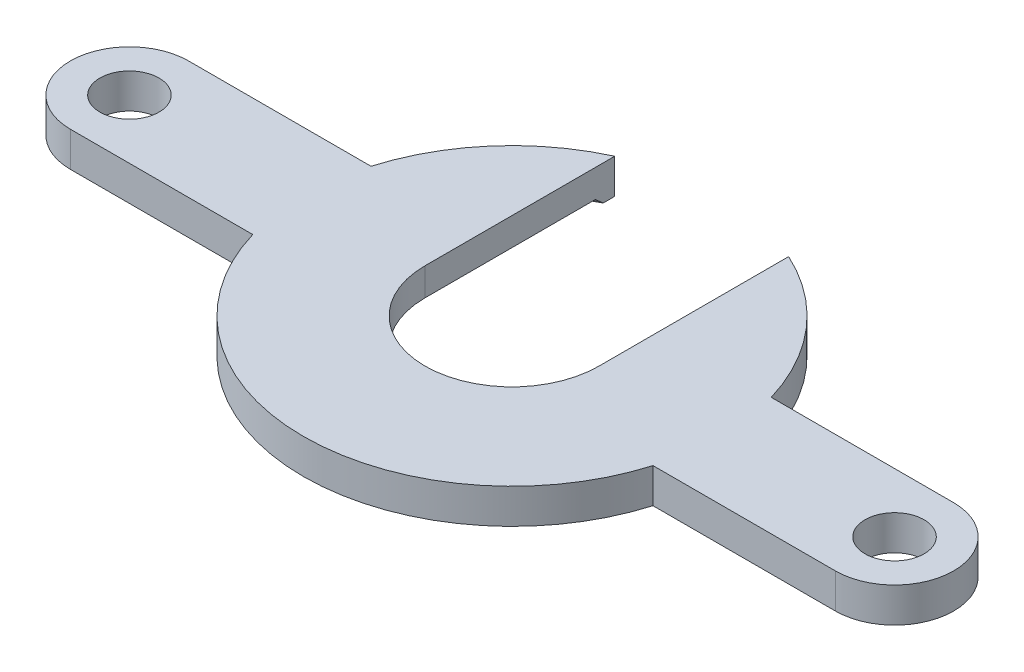
from build123d import *

# Parameters (mm, degrees)
SKETCH1_R           = 4.25
BOSS_EXTRUDE1_DEPTH = 5
SKETCH2_R           = 27.5
CUT_EXTRUDE1_DEPTH  = 1
CHAMFER1_SIZE       = 1


with BuildPart() as part:
    # Sketch1 → Boss-Extrude1 (new body)
    with BuildSketch(Plane(origin=(0, 0, 0), x_dir=(1, 0, 0), z_dir=(0, 1, 0))):
        with BuildLine():
            Line((55, 8.5), (28.770644762, 8.5))
            ThreePointArc((28.770644762, 8.5), (22.669615426, 19.649135769), (12.5, 27.271780287))
            Line((12.5, 27.271780287), (12.5, 0))
            ThreePointArc((12.5, 0), (0, -12.5), (-12.5, 0))
            Line((-12.5, 0), (-12.5, 27.271780287))
            ThreePointArc((-12.5, 27.271780287), (-22.669615426, 19.649135769), (-28.770644762, 8.5))
            Line((-28.770644762, 8.5), (-55, 8.5))
            ThreePointArc((-55, 8.5), (-63.5, 0), (-55, -8.5))
            Line((-55, -8.5), (-28.770644762, -8.5))
            ThreePointArc((-28.770644762, -8.5), (0, -30), (28.770644762, -8.5))
            Line((28.770644762, -8.5), (55, -8.5))
            ThreePointArc((55, -8.5), (63.5, 0), (55, 8.5))
        make_face()
        with Locations(Location((-55, 0, 0), (0, 0, 270))):
            Circle(SKETCH1_R, mode=Mode.SUBTRACT)
        with Locations(Location((55, 0, 0), (0, 0, 270))):
            Circle(SKETCH1_R, mode=Mode.SUBTRACT)
    extrude(amount=BOSS_EXTRUDE1_DEPTH)

    # Sketch2 → Cut-Extrude1 (cut)
    with BuildSketch(Plane(origin=(0, 0, 0), x_dir=(1, 0, 0), z_dir=(0, 1, 0))):
        Circle(SKETCH2_R)
    extrude(amount=CUT_EXTRUDE1_DEPTH, mode=Mode.SUBTRACT)

    # Chamfer1
    chamfer1_edges = [part.edges().sort_by_distance(p)[0] for p in [
        (0, 0, 27.5),
    ]]
    chamfer(chamfer1_edges, length=CHAMFER1_SIZE - 0.0001)  # a hair under: the kernel refuses the full size


solid = part.part
